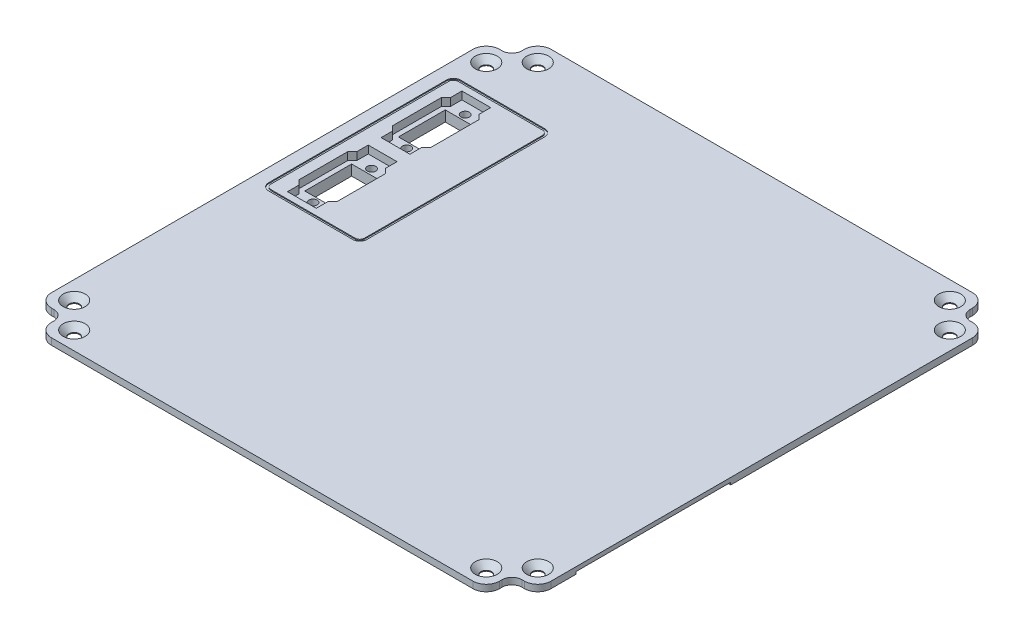
from build123d import *
from OCP.BRepFilletAPI import BRepFilletAPI_MakeChamfer, BRepFilletAPI_MakeFillet

# Parameters (mm, degrees)
SKETCH1_W                     = 214
SKETCH1_H                     = 214
BOSS_EXTRUDE1_DEPTH           = 2.8
SKETCH2_W                     = 11
SKETCH2_H                     = 11
CUT_EXTRUDE1_DEPTH            = 152.346754177
FILLET1_R1                    = 6
FILLET1_R2                    = 4
CIRPATTERN1_COUNT             = 4
FILLET1_OF_CIRPATTERN1_R1     = 6
FILLET1_OF_CIRPATTERN1_R2     = 4
FILLET1_OF_CIRPATTERN1_R3     = 6
FILLET1_OF_CIRPATTERN1_R4     = 4
FILLET1_OF_CIRPATTERN1_R5     = 6
FILLET1_OF_CIRPATTERN1_R6     = 4
CUT_EXTRUDE2_DEPTH            = 152.346754177
SKETCH7_R                     = 4.7
BOSS_EXTRUDE2_DEPTH           = 2.8
SKETCH8_W                     = 5
SKETCH8_H                     = 64.2
SKETCH8_H_2                   = 5
SKETCH8_H_3                   = 35
SKETCH8_W_2                   = 35
SKETCH8_W_3                   = 64.2
BOSS_EXTRUDE4_DEPTH           = 5
CHAMFER1_SIZE                 = 5
CHAMFER1_SIZE2                = 35
BOSS_EXTRUDE5_REACH           = 152.979
SKETCH10_W                    = 35
SKETCH10_H                    = 10.8
SKETCH10_H_2                  = 74.2
SKETCH10_H_3                  = 5
SKETCH9_W                     = 12
SKETCH9_H                     = 20
CUT_EXTRUDE3_DEPTH            = 3.3
SKETCH16_W                    = 12
SKETCH16_H                    = 20
CUT_EXTRUDE6_DEPTH            = 152.098047638
M3_CLEARANCE_HOLE1_AT_2_COUNT = 2
M3_CLEARANCE_HOLE1_AT_2_PITCH = 25
CUT_EXTRUDE_THIN1_DEPTH       = 0.4
LPATTERN1_COUNT               = 2
LPATTERN1_PITCH               = 40
SKETCH11_W                    = 4
SKETCH11_H                    = 143.4
SKETCH11_W_2                  = 143.4
SKETCH11_H_2                  = 4
SKETCH11_H_3                  = 10
CUT_EXTRUDE4_DEPTH            = 151.979402569
SKETCH12_W                    = 10.2
SKETCH12_H                    = 90
CUT_EXTRUDE5_DEPTH            = 151.979402569
CUT_EXTRUDE7_START            = -1
SKETCH17_W                    = 35
SKETCH17_H                    = 66
CUT_EXTRUDE7_DEPTH            = 152.979402569
SKETCH19_W                    = 8
SKETCH19_H                    = 64.2
BOSS_EXTRUDE6_DEPTH           = 5
CUT_EXTRUDE9_DEPTH            = 5


# Read off the part's stored shape, not the designer's step: CSK for M4 Flat Head Machine Screw1
with BuildPart() as part:
    # Sketch1 → Boss-Extrude1 (new body)
    with BuildSketch(Plane(origin=(0, 0, 0), x_dir=(1, 0, 0), z_dir=(0, 1, 0))):
        Rectangle(SKETCH1_W, SKETCH1_H)
    extrude(amount=BOSS_EXTRUDE1_DEPTH)

    # Sketch2 → Cut-Extrude1 (cut, through all)
    with BuildSketch(Plane(origin=(0, 2.8, 0), x_dir=(1, 0, 0), z_dir=(0, 1, 0))):
        with Locations((-101.5, -101.5)):
            Rectangle(SKETCH2_W, SKETCH2_H)
    cut_extrude1 = extrude(amount=-CUT_EXTRUDE1_DEPTH, mode=Mode.SUBTRACT)

    # Fillet1: one fillet with a radius per group of edges: ONE call of the kernel's fillet builder (fillet() takes one radius for all edges)
    fillet1_edges_1 = [part.edges().sort_by_distance(p)[0] for p in [
        (-107, 1.4, 96),
        (-96, 1.4, 107),
    ]]
    fillet1_edges_2 = [part.edges().sort_by_distance(p)[0] for p in [
        (-96, 1.4, 96),
    ]]
    fillet1 = BRepFilletAPI_MakeFillet(part.part.solid().wrapped)
    for e in fillet1_edges_1:
        fillet1.Add(FILLET1_R1, e.wrapped)
    for e in fillet1_edges_2:
        fillet1.Add(FILLET1_R2, e.wrapped)
    add(Compound.cast(fillet1.Shape()), mode=Mode.REPLACE)

    # CirPattern1: Cut-Extrude1 ×4 about axis
    cirpattern1_axis = Axis((0, 0, 0), (0, 1, 0))
    for i in range(1, CIRPATTERN1_COUNT):
        add(cut_extrude1.rotate(cirpattern1_axis, i * 360 / CIRPATTERN1_COUNT), mode=Mode.SUBTRACT)

    # Fillet1 of CirPattern1: one fillet with a radius per group of edges: ONE call of the kernel's fillet builder (fillet() takes one radius for all edges)
    fillet1_of_cirpattern1_edges_1 = [part.edges().sort_by_distance(p)[0] for p in [
        (96, 1.4, 107),
        (107, 1.4, 96),
    ]]
    fillet1_of_cirpattern1_edges_2 = [part.edges().sort_by_distance(p)[0] for p in [
        (96, 1.4, 96),
    ]]
    fillet1_of_cirpattern1_edges_3 = [part.edges().sort_by_distance(p)[0] for p in [
        (107, 1.4, -96),
        (96, 1.4, -107),
    ]]
    fillet1_of_cirpattern1_edges_4 = [part.edges().sort_by_distance(p)[0] for p in [
        (96, 1.4, -96),
    ]]
    fillet1_of_cirpattern1_edges_5 = [part.edges().sort_by_distance(p)[0] for p in [
        (-96, 1.4, -107),
        (-107, 1.4, -96),
    ]]
    fillet1_of_cirpattern1_edges_6 = [part.edges().sort_by_distance(p)[0] for p in [
        (-96, 1.4, -96),
    ]]
    fillet1_of_cirpattern1 = BRepFilletAPI_MakeFillet(part.part.solid().wrapped)
    for e in fillet1_of_cirpattern1_edges_1:
        fillet1_of_cirpattern1.Add(FILLET1_OF_CIRPATTERN1_R1, e.wrapped)
    for e in fillet1_of_cirpattern1_edges_2:
        fillet1_of_cirpattern1.Add(FILLET1_OF_CIRPATTERN1_R2, e.wrapped)
    for e in fillet1_of_cirpattern1_edges_3:
        fillet1_of_cirpattern1.Add(FILLET1_OF_CIRPATTERN1_R3, e.wrapped)
    for e in fillet1_of_cirpattern1_edges_4:
        fillet1_of_cirpattern1.Add(FILLET1_OF_CIRPATTERN1_R4, e.wrapped)
    for e in fillet1_of_cirpattern1_edges_5:
        fillet1_of_cirpattern1.Add(FILLET1_OF_CIRPATTERN1_R5, e.wrapped)
    for e in fillet1_of_cirpattern1_edges_6:
        fillet1_of_cirpattern1.Add(FILLET1_OF_CIRPATTERN1_R6, e.wrapped)
    add(Compound.cast(fillet1_of_cirpattern1.Shape()), mode=Mode.REPLACE)

    # Sketch3 → Cut-Extrude2 (cut, through all)
    with BuildSketch(Plane(origin=(0, 2.8, 0), x_dir=(1, 0, 0), z_dir=(0, 1, 0))):
        with BuildLine():
            Line((100, -96), (101, -96))
            ThreePointArc((101, -96), (105.242640687, -94.242640687), (107, -90))
            Line((107, -90), (107, 90))
            ThreePointArc((107, 90), (105.242640687, 94.242640687), (101, 96))
            Line((101, 96), (100, 96))
            ThreePointArc((100, 96), (97.171572875, 97.171572875), (96, 100))
            Line((96, 100), (96, 101))
            ThreePointArc((96, 101), (94.242640687, 105.242640687), (90, 107))
            Line((90, 107), (-90, 107))
            ThreePointArc((-90, 107), (-94.242640687, 105.242640687), (-96, 101))
            Line((-96, 101), (-96, 100))
            ThreePointArc((-96, 100), (-97.171572875, 97.171572875), (-100, 96))
            Line((-100, 96), (-101, 96))
            ThreePointArc((-101, 96), (-105.242640687, 94.242640687), (-107, 90))
            Line((-107, 90), (-107, -90))
            ThreePointArc((-107, -90), (-105.242640687, -94.242640687), (-101, -96))
            Line((-101, -96), (-100, -96))
            ThreePointArc((-100, -96), (-97.171572875, -97.171572875), (-96, -100))
            Line((-96, -100), (-96, -101))
            ThreePointArc((-96, -101), (-94.242640687, -105.242640687), (-90, -107))
            Line((-90, -107), (90, -107))
            ThreePointArc((90, -107), (94.242640687, -105.242640687), (96, -101))
            Line((96, -101), (96, -100))
            ThreePointArc((96, -100), (97.171572875, -97.171572875), (100, -96))
        make_face()
        with BuildLine():
            Line((100, -95.7), (101, -95.7))
            ThreePointArc((101, -95.7), (105.030508653, -94.030508653), (106.7, -90))
            Line((106.7, -90), (106.7, 90))
            ThreePointArc((106.7, 90), (105.030508653, 94.030508653), (101, 95.7))
            Line((101, 95.7), (100, 95.7))
            ThreePointArc((100, 95.7), (96.959440841, 96.959440841), (95.7, 100))
            Line((95.7, 100), (95.7, 101))
            ThreePointArc((95.7, 101), (94.030508653, 105.030508653), (90, 106.7))
            Line((90, 106.7), (-90, 106.7))
            ThreePointArc((-90, 106.7), (-94.030508653, 105.030508653), (-95.7, 101))
            Line((-95.7, 101), (-95.7, 100))
            ThreePointArc((-95.7, 100), (-96.959440841, 96.959440841), (-100, 95.7))
            Line((-100, 95.7), (-101, 95.7))
            ThreePointArc((-101, 95.7), (-105.030508653, 94.030508653), (-106.7, 90))
            Line((-106.7, 90), (-106.7, -90))
            ThreePointArc((-106.7, -90), (-105.030508653, -94.030508653), (-101, -95.7))
            Line((-101, -95.7), (-100, -95.7))
            ThreePointArc((-100, -95.7), (-96.959440841, -96.959440841), (-95.7, -100))
            Line((-95.7, -100), (-95.7, -101))
            ThreePointArc((-95.7, -101), (-94.030508653, -105.030508653), (-90, -106.7))
            Line((-90, -106.7), (90, -106.7))
            ThreePointArc((90, -106.7), (94.030508653, -105.030508653), (95.7, -101))
            Line((95.7, -101), (95.7, -100))
            ThreePointArc((95.7, -100), (96.959440841, -96.959440841), (100, -95.7))
        make_face(mode=Mode.SUBTRACT)
    extrude(amount=-CUT_EXTRUDE2_DEPTH, mode=Mode.SUBTRACT)

    # CSK for M4 Flat Head Machine Screw1 outl → CSK for M4 Flat Head Machine Screw1 (revolve, cut)
    with BuildSketch(Plane(origin=(-99, 0, 88), x_dir=(1, 0, 0), z_dir=(0, 0, 1))):
        Polygon((0, 0), (2.25, 0), (2.25, 0.35), (4.7, 2.8), (0, 2.8), align=None)
    revolve(axis=Axis((-99, 0, 88), (0, 1, 0)), mode=Mode.SUBTRACT)

    # CSK for M4 Flat Head Machine Screw1 2 ou → CSK for M4 Flat Head Machine Screw1 2 (revolve, cut)
    with BuildSketch(Plane(origin=(99, 0, -88), x_dir=(1, 0, 0), z_dir=(0, 0, 1))):
        Polygon((0, 0), (2.25, 0), (2.25, 0.35), (4.7, 2.8), (0, 2.8), align=None)
    revolve(axis=Axis((99, 0, -88), (0, 1, 0)), mode=Mode.SUBTRACT)

    # CSK for M4 Flat Head Machine Screw1 3 ou → CSK for M4 Flat Head Machine Screw1 3 (revolve, cut)
    with BuildSketch(Plane(origin=(99, 0, 88), x_dir=(1, 0, 0), z_dir=(0, 0, 1))):
        Polygon((0, 0), (2.25, 0), (2.25, 0.35), (4.7, 2.8), (0, 2.8), align=None)
    revolve(axis=Axis((99, 0, 88), (0, 1, 0)), mode=Mode.SUBTRACT)

    # CSK for M4 Flat Head Machine Screw1 4 ou → CSK for M4 Flat Head Machine Screw1 4 (revolve, cut)
    with BuildSketch(Plane(origin=(-99, 0, -88), x_dir=(1, 0, 0), z_dir=(0, 0, 1))):
        Polygon((0, 0), (2.25, 0), (2.25, 0.35), (4.7, 2.8), (0, 2.8), align=None)
    revolve(axis=Axis((-99, 0, -88), (0, 1, 0)), mode=Mode.SUBTRACT)

    # CSK for M4 Flat Head Machine Screw1 5 ou → CSK for M4 Flat Head Machine Screw1 5 (revolve, cut)
    with BuildSketch(Plane.XY):
        Polygon((0, 0), (2.25, 0), (2.25, 0.35), (4.7, 2.8), (0, 2.8), align=None)
    revolve(axis=Axis((0, 0, 0), (0, 1, 0)), mode=Mode.SUBTRACT)

    # CSK for M4 Flat Head Machine Screw1 6 ou → CSK for M4 Flat Head Machine Screw1 6 (revolve, cut)
    with BuildSketch(Plane(origin=(-88, 0, 99), x_dir=(1, 0, 0), z_dir=(0, 0, 1))):
        Polygon((0, 0), (2.25, 0), (2.25, 0.35), (4.7, 2.8), (0, 2.8), align=None)
    revolve(axis=Axis((-88, 0, 99), (0, 1, 0)), mode=Mode.SUBTRACT)

    # CSK for M4 Flat Head Machine Screw1 7 ou → CSK for M4 Flat Head Machine Screw1 7 (revolve, cut)
    with BuildSketch(Plane(origin=(88, 0, -99), x_dir=(1, 0, 0), z_dir=(0, 0, 1))):
        Polygon((0, 0), (2.25, 0), (2.25, 0.35), (4.7, 2.8), (0, 2.8), align=None)
    revolve(axis=Axis((88, 0, -99), (0, 1, 0)), mode=Mode.SUBTRACT)

    # CSK for M4 Flat Head Machine Screw1 8 ou → CSK for M4 Flat Head Machine Screw1 8 (revolve, cut)
    with BuildSketch(Plane(origin=(88, 0, 99), x_dir=(1, 0, 0), z_dir=(0, 0, 1))):
        Polygon((0, 0), (2.25, 0), (2.25, 0.35), (4.7, 2.8), (0, 2.8), align=None)
    revolve(axis=Axis((88, 0, 99), (0, 1, 0)), mode=Mode.SUBTRACT)

    # CSK for M4 Flat Head Machine Screw1 9 ou → CSK for M4 Flat Head Machine Screw1 9 (revolve, cut)
    with BuildSketch(Plane(origin=(-88, 0, -99), x_dir=(1, 0, 0), z_dir=(0, 0, 1))):
        Polygon((0, 0), (2.25, 0), (2.25, 0.35), (4.7, 2.8), (0, 2.8), align=None)
    revolve(axis=Axis((-88, 0, -99), (0, 1, 0)), mode=Mode.SUBTRACT)

    # Sketch7 → Boss-Extrude2 (add, through all)
    with BuildSketch(Plane(origin=(0, 2.8, 0), x_dir=(1, 0, 0), z_dir=(0, 1, 0))):
        Circle(SKETCH7_R)
    extrude(amount=-BOSS_EXTRUDE2_DEPTH)

    # Sketch8 → Boss-Extrude4 (add)
    with BuildSketch(Plane.XZ):
        with Locations((69.2, -34.6)):
            Rectangle(SKETCH8_W, SKETCH8_H)
        with Locations((69.2, -69.2)):
            Rectangle(SKETCH8_W, SKETCH8_H_2)
        with Locations((69.2, -89.2)):
            Rectangle(SKETCH8_W, SKETCH8_H_3)
        with Locations((89.2, -69.2)):
            Rectangle(SKETCH8_W_2, SKETCH8_H_2)
        with Locations((34.6, -69.2)):
            Rectangle(SKETCH8_W_3, SKETCH8_H_2)
        with Locations((0, -89.2)):
            Rectangle(SKETCH8_W, SKETCH8_H_3)
        with Locations((0, -69.2)):
            Rectangle(SKETCH8_W, SKETCH8_H_2)
        with Locations((-34.6, -69.2)):
            Rectangle(SKETCH8_W_3, SKETCH8_H_2)
        with Locations((0, -34.6)):
            Rectangle(SKETCH8_W, SKETCH8_H)
        with Locations((-89.2, -69.2)):
            Rectangle(SKETCH8_W_2, SKETCH8_H_2)
        with Locations((-69.2, -69.2)):
            Rectangle(SKETCH8_W, SKETCH8_H_2)
        with Locations((-69.2, -89.2)):
            Rectangle(SKETCH8_W, SKETCH8_H_3)
        with Locations((-69.2, -34.6)):
            Rectangle(SKETCH8_W, SKETCH8_H)
        with Locations((-89.2, 0)):
            Rectangle(SKETCH8_W_2, SKETCH8_H_2)
        with Locations((-69.2, 0)):
            Rectangle(SKETCH8_W, SKETCH8_H_2)
        with Locations((-69.2, 34.6)):
            Rectangle(SKETCH8_W, SKETCH8_H)
        with Locations((-34.6, 0)):
            Rectangle(SKETCH8_W_3, SKETCH8_H_2)
        with Locations((-89.2, 69.2)):
            Rectangle(SKETCH8_W_2, SKETCH8_H_2)
        with Locations((-69.2, 69.2)):
            Rectangle(SKETCH8_W, SKETCH8_H_2)
        with Locations((-69.2, 89.2)):
            Rectangle(SKETCH8_W, SKETCH8_H_3)
        with Locations((-34.6, 69.2)):
            Rectangle(SKETCH8_W_3, SKETCH8_H_2)
        with Locations((89.2, 0)):
            Rectangle(SKETCH8_W_2, SKETCH8_H_2)
        with Locations((69.2, 0)):
            Rectangle(SKETCH8_W, SKETCH8_H_2)
        with Locations((69.2, 34.6)):
            Rectangle(SKETCH8_W, SKETCH8_H)
        with Locations((34.6, 0)):
            Rectangle(SKETCH8_W_3, SKETCH8_H_2)
        Rectangle(SKETCH8_W, SKETCH8_H_2)
        with Locations((0, 34.6)):
            Rectangle(SKETCH8_W, SKETCH8_H)
        with Locations((0, 69.2)):
            Rectangle(SKETCH8_W, SKETCH8_H_2)
        with Locations((0, 89.2)):
            Rectangle(SKETCH8_W, SKETCH8_H_3)
        with Locations((34.6, 69.2)):
            Rectangle(SKETCH8_W_3, SKETCH8_H_2)
        with Locations((69.2, 69.2)):
            Rectangle(SKETCH8_W, SKETCH8_H_2)
        with Locations((69.2, 89.2)):
            Rectangle(SKETCH8_W, SKETCH8_H_3)
        with Locations((89.2, 69.2)):
            Rectangle(SKETCH8_W_2, SKETCH8_H_2)
    extrude(amount=BOSS_EXTRUDE4_DEPTH)

    # Chamfer1: one chamfer whose edges measure the first distance from different faces: ONE call of the kernel's chamfer builder (chamfer() names one face for all edges)
    chamfer1_edges_1 = [part.edges().sort_by_distance(p)[0] for p in [
        (69.2, -5, -106.7),
        (0, -5, -106.7),
        (-69.2, -5, -106.7),
    ]]
    chamfer1_side_1 = [part.faces().sort_by_distance(p)[0] for p in [
        (0, 0.894818653, -106.7),
    ]]
    chamfer1_edges_2 = [part.edges().sort_by_distance(p)[0] for p in [
        (69.2, -5, 106.7),
        (0, -5, 106.7),
        (-69.2, -5, 106.7),
    ]]
    chamfer1_side_2 = [part.faces().sort_by_distance(p)[0] for p in [
        (0, 0.894818653, 106.7),
    ]]
    chamfer1_edges_3 = [part.edges().sort_by_distance(p)[0] for p in [
        (106.7, -5, 0),
        (106.7, -5, 69.2),
        (106.7, -5, -69.2),
    ]]
    chamfer1_side_3 = [part.faces().sort_by_distance(p)[0] for p in [
        (106.7, 0.894818653, 0),
    ]]
    chamfer1_edges_4 = [part.edges().sort_by_distance(p)[0] for p in [
        (-106.7, -5, 69.2),
        (-106.7, -5, 0),
        (-106.7, -5, -69.2),
    ]]
    chamfer1_side_4 = [part.faces().sort_by_distance(p)[0] for p in [
        (-106.7, 0.894818653, 0),
    ]]
    chamfer1 = BRepFilletAPI_MakeChamfer(part.part.solid().wrapped)
    for e in chamfer1_edges_1:
        chamfer1.Add(CHAMFER1_SIZE, CHAMFER1_SIZE2, e.wrapped, chamfer1_side_1[0].wrapped)  # the first distance lies on this face
    for e in chamfer1_edges_2:
        chamfer1.Add(CHAMFER1_SIZE, CHAMFER1_SIZE2, e.wrapped, chamfer1_side_2[0].wrapped)  # the first distance lies on this face
    for e in chamfer1_edges_3:
        chamfer1.Add(CHAMFER1_SIZE, CHAMFER1_SIZE2, e.wrapped, chamfer1_side_3[0].wrapped)  # the first distance lies on this face
    for e in chamfer1_edges_4:
        chamfer1.Add(CHAMFER1_SIZE, CHAMFER1_SIZE2, e.wrapped, chamfer1_side_4[0].wrapped)  # the first distance lies on this face
    add(Compound.cast(chamfer1.Shape()), mode=Mode.REPLACE)

    # Boss-Extrude5: up to this face of the body (flat: up to its plane)
    boss_extrude5_end = Plane(part.part.faces().sort_by_distance((0, -5, 0))[0])
    # Sketch10 → Boss-Extrude5 (add, up to the picked face)
    with BuildSketch(Plane.XZ, mode=Mode.PRIVATE) as boss_extrude5_sk1:
        with Locations((-89.2, 7.9)):
            Rectangle(SKETCH10_W, SKETCH10_H)
    boss_extrude5_tool1 = split(extrude(boss_extrude5_sk1.sketch, amount=BOSS_EXTRUDE5_REACH, mode=Mode.PRIVATE), bisect_by=boss_extrude5_end, keep=Keep.BOTH, mode=Mode.PRIVATE)
    # Sketch10 → Boss-Extrude5 (add, up to the picked face)
    with BuildSketch(Plane.XZ, mode=Mode.PRIVATE) as boss_extrude5_sk2:
        with Locations((-89.2, -34.6)):
            Rectangle(SKETCH10_W, SKETCH10_H_2)
    boss_extrude5_tool2 = split(extrude(boss_extrude5_sk2.sketch, amount=BOSS_EXTRUDE5_REACH, mode=Mode.PRIVATE), bisect_by=boss_extrude5_end, keep=Keep.BOTH, mode=Mode.PRIVATE)
    # Sketch10 → Boss-Extrude5 (add, up to the picked face)
    with BuildSketch(Plane.XZ, mode=Mode.PRIVATE) as boss_extrude5_sk3:
        with Locations((-89.2, -74.2)):
            Rectangle(SKETCH10_W, SKETCH10_H_3)
    boss_extrude5_tool3 = split(extrude(boss_extrude5_sk3.sketch, amount=BOSS_EXTRUDE5_REACH, mode=Mode.PRIVATE), bisect_by=boss_extrude5_end, keep=Keep.BOTH, mode=Mode.PRIVATE)
    add(boss_extrude5_tool1.solids().sort_by(Axis((-89.2, 0, 7.9), (0, -1, 0)))[0])
    add(boss_extrude5_tool2.solids().sort_by(Axis((-89.2, 0, -34.6), (0, -1, 0)))[0])
    add(boss_extrude5_tool3.solids().sort_by(Axis((-89.2, 0, -74.2), (0, -1, 0)))[0])

    # Sketch9 → Cut-Extrude3 (cut)
    with BuildSketch(Plane(origin=(0, 2.8, 0), x_dir=(1, 0, 0), z_dir=(0, 1, 0))):
        Polygon((-79.4, 44.6), (-79.4, 65.4), (-81.35, 67.35), (-81.35, 72.25), (-93.65, 72.25), (-93.65, 67.35), (-95.6, 65.4), (-95.6, 44.6), (-93.65, 42.65), (-93.65, 37.75), (-81.35, 37.75), (-81.35, 42.65), align=None)
        with Locations((-87.5, 55)):
            Rectangle(SKETCH9_W, SKETCH9_H, mode=Mode.SUBTRACT)
    cut_extrude3 = extrude(amount=-CUT_EXTRUDE3_DEPTH, mode=Mode.SUBTRACT)

    # Sketch16 → Cut-Extrude6 (cut, through all)
    with BuildSketch(Plane(origin=(0, 2.8, 0), x_dir=(1, 0, 0), z_dir=(0, 1, 0))):
        with Locations((-87.5, 55)):
            Rectangle(SKETCH16_W, SKETCH16_H)
    cut_extrude6 = extrude(amount=-CUT_EXTRUDE6_DEPTH, mode=Mode.SUBTRACT)

    # Sketch15 → M3 Clearance Hole1 (revolve, cut)
    with BuildSketch(Plane(origin=(-87.5, -0.5, -67.5), x_dir=(0, 0, 1), z_dir=(1, 0, 0))):
        Polygon((0, 0), (0, 7.081549114), (1.8, 6), (1.8, 0), align=None)
    m3_clearance_hole1 = revolve(axis=Axis((-87.5, 5.85, -67.5), (0, -1, 0)), mode=Mode.SUBTRACT)

    # M3 Clearance Hole1 at 2: M3 Clearance Hole1 ×2
    with Locations(*[(0, 0, i * M3_CLEARANCE_HOLE1_AT_2_PITCH) for i in range(1, M3_CLEARANCE_HOLE1_AT_2_COUNT)]):
        add(m3_clearance_hole1, mode=Mode.SUBTRACT)

    # Sketch9<3> → Cut-Extrude-Thin1 (cut)
    with BuildSketch(Plane(origin=(0, 2.8, 0), x_dir=(1, 0, 0), z_dir=(0, 1, 0))):
        with BuildLine():
            Line((-59, 73), (-59, -3))
            ThreePointArc((-59, -3), (-59.878679656, -5.121320344), (-62, -6))
            Line((-62, -6), (-98, -6))
            ThreePointArc((-98, -6), (-100.121320344, -5.121320344), (-101, -3))
            Line((-101, -3), (-101, 73))
            ThreePointArc((-101, 73), (-100.121320344, 75.121320344), (-98, 76))
            Line((-98, 76), (-62, 76))
            ThreePointArc((-62, 76), (-59.878679656, 75.121320344), (-59, 73))
        make_face()
        with BuildLine():
            Line((-60, 73), (-60, -3))
            ThreePointArc((-60, -3), (-60.585786438, -4.414213562), (-62, -5))
            Line((-62, -5), (-98, -5))
            ThreePointArc((-98, -5), (-99.414213562, -4.414213562), (-100, -3))
            Line((-100, -3), (-100, 73))
            ThreePointArc((-100, 73), (-99.414213562, 74.414213562), (-98, 75))
            Line((-98, 75), (-62, 75))
            ThreePointArc((-62, 75), (-60.585786438, 74.414213562), (-60, 73))
        make_face(mode=Mode.SUBTRACT)
    extrude(amount=-CUT_EXTRUDE_THIN1_DEPTH, mode=Mode.SUBTRACT)

    # LPattern1: Cut-Extrude3, Cut-Extrude6, M3 Clearance Hole1 ×2
    with Locations(*[(0, 0, i * LPATTERN1_PITCH) for i in range(1, LPATTERN1_COUNT)]):
        add(cut_extrude3, mode=Mode.SUBTRACT)
        add(cut_extrude6, mode=Mode.SUBTRACT)
        add(m3_clearance_hole1, mode=Mode.SUBTRACT)

    # LPattern1 copy 1 sketch → LPattern1 copy 1 (revolve, cut)
    with BuildSketch(Plane(origin=(-87.5, -0.5, -2.5), x_dir=(0, 0, 1), z_dir=(1, 0, 0))):
        Polygon((0, 0), (0, 7.081549114), (1.8, 6), (1.8, 0), align=None)
    revolve(axis=Axis((-87.5, 5.85, -2.5), (0, -1, 0)), mode=Mode.SUBTRACT)

    # Sketch11 → Cut-Extrude4 (cut, through all)
    with BuildSketch(Plane.XZ):
        with Locations((104.7, 0)):
            Rectangle(SKETCH11_W, SKETCH11_H)
        with Locations((0, -104.7)):
            Rectangle(SKETCH11_W_2, SKETCH11_H_2)
        with Locations((0, 104.7)):
            Rectangle(SKETCH11_W_2, SKETCH11_H_2)
        with Locations((-104.7, 66.7)):
            Rectangle(SKETCH11_W, SKETCH11_H_3)
    extrude(amount=CUT_EXTRUDE4_DEPTH, mode=Mode.SUBTRACT)

    # Sketch12 → Cut-Extrude5 (cut, through all)
    with BuildSketch(Plane.XZ):
        with Locations((-101.6, -31.7)):
            Rectangle(SKETCH12_W, SKETCH12_H)
    extrude(amount=CUT_EXTRUDE5_DEPTH, mode=Mode.SUBTRACT)

    # Sketch17 → Cut-Extrude7 (cut)
    with BuildSketch(Plane.XZ.offset(CUT_EXTRUDE7_START)):
        with Locations((-89.2, 46.3)):
            Rectangle(SKETCH17_W, SKETCH17_H)
    cut_extrude7 = extrude(amount=CUT_EXTRUDE7_DEPTH, mode=Mode.SUBTRACT)

    # Mirror1: Cut-Extrude7 across plane
    add(cut_extrude7.mirror(Plane(origin=(0, 0, 0), x_dir=(0, 0, 1), z_dir=(1, 0, 0))), mode=Mode.SUBTRACT)

    # Sketch19 → Boss-Extrude6 (add)
    with BuildSketch(Plane.XZ):
        with Locations((-62.7, -34.6)):
            Rectangle(SKETCH19_W, SKETCH19_H)
    extrude(amount=BOSS_EXTRUDE6_DEPTH)

    # Sketch20 → Cut-Extrude9 (cut)
    with BuildSketch(Plane.XZ.offset(5)):
        Polygon((-96.5, 0.3), (-87.5, 9.3), (-87.5, 13.3), (-96.5, 13.3), align=None)
    extrude(amount=-CUT_EXTRUDE9_DEPTH, mode=Mode.SUBTRACT)


solid = part.part
